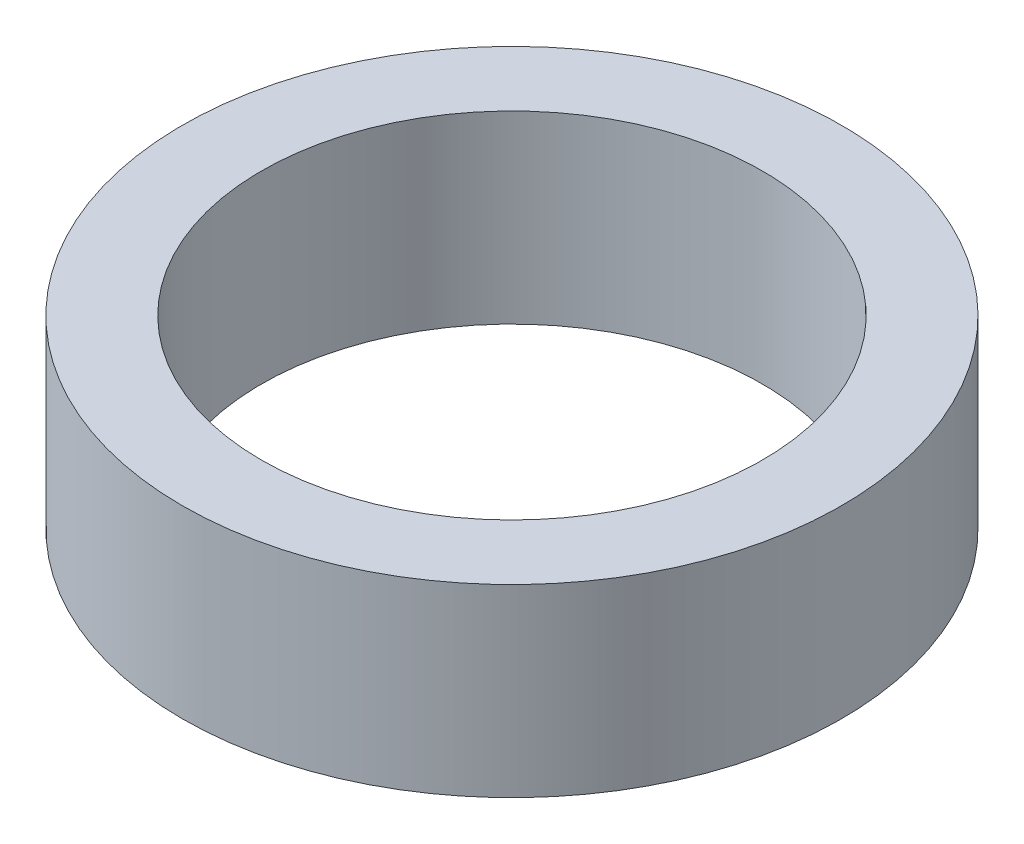
from build123d import *

# Parameters (mm, degrees)
SKETCH1_R           = 6.25
SKETCH1_R_2         = 4.75
BOSS_EXTRUDE1_DEPTH = 3.5


with BuildPart() as part:
    # Sketch1 → Boss-Extrude1 (new body)
    with BuildSketch(Plane(origin=(0, 0, 0), x_dir=(1, 0, 0), z_dir=(0, 1, 0))):
        Circle(SKETCH1_R)
        Circle(SKETCH1_R_2, mode=Mode.SUBTRACT)
    extrude(amount=BOSS_EXTRUDE1_DEPTH)


solid = part.part
